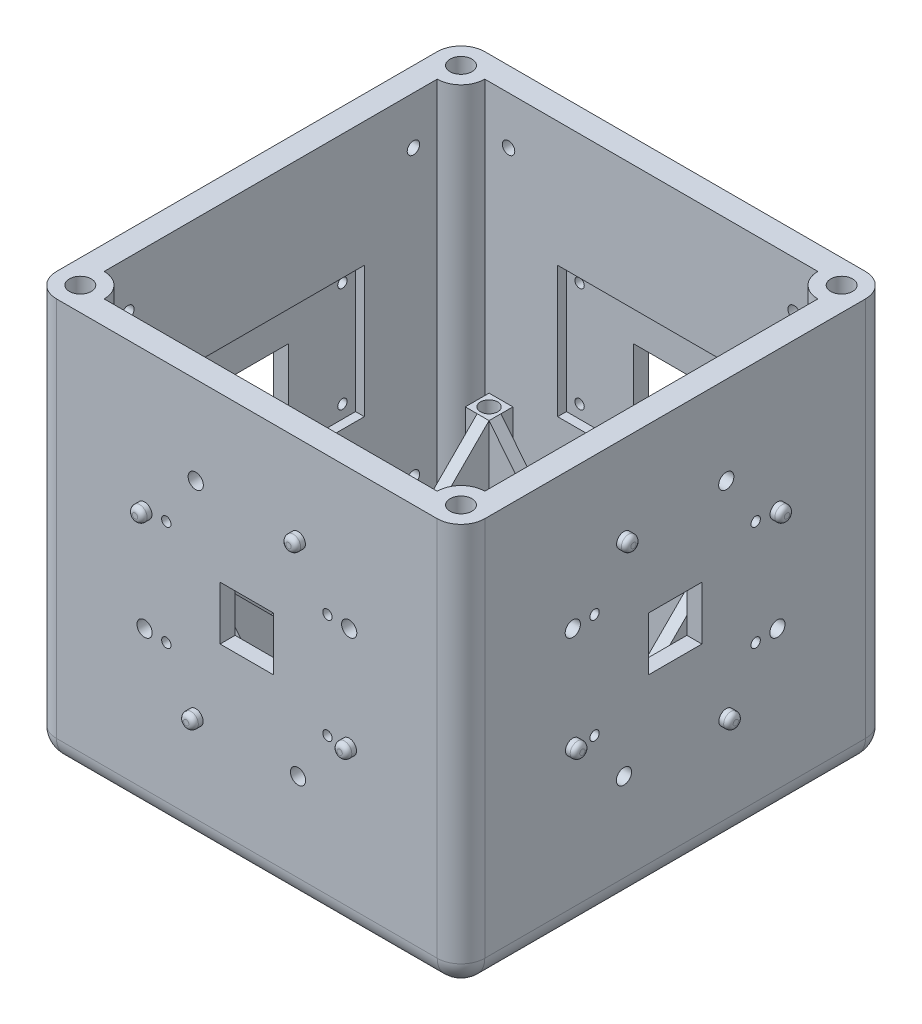
from build123d import *

# Parameters (mm, degrees)
SKETCH1_W                                    = 114.3
SKETCH1_H                                    = 114.3
BOSS_EXTRUDE1_DEPTH                          = 53.975
SHELL1_T                                     = -6.35
SKETCH3_W                                    = 6.35
SKETCH3_H                                    = 101.6
REVOLVE1_ANGLE                               = 90
MIRROR1_AT_THE_SECOND_PLANE_COPY_1_SKETC_W   = 6.35
MIRROR1_AT_THE_SECOND_PLANE_COPY_1_SKETC_H   = 101.6
MIRROR1_AT_THE_SECOND_PLANE_COPY_1_ANGLE     = 90
SKETCH16_W                                   = 14.2875
SKETCH16_H                                   = 14.2875
CUT_EXTRUDE1_DEPTH                           = 4
MIRROR4_AT_THE_SECOND_PLANE_COPY_1_SKETC_W   = 14.2875
MIRROR4_AT_THE_SECOND_PLANE_COPY_1_SKETC_H   = 14.2875
MIRROR4_AT_THE_SECOND_PLANE_COPY_1_DEPTH     = 4
FILLET1_R                                    = 6.35
SKETCH22_R                                   = 2.92
CUT_EXTRUDE5_DEPTH                           = 5.007428571
MIRROR6_AT_THE_SECOND_PLANE_COPY_1_SKETC_R   = 2.92
MIRROR6_AT_THE_SECOND_PLANE_COPY_1_DEPTH     = 5.007428571
SKETCH25_R                                   = 1.9685
BOSS_EXTRUDE2_DEPTH                          = 2.54
SKETCH25_3_R                                 = 2.032
CUT_EXTRUDE6_DEPTH                           = 3.048
FILLET5_R                                    = 1.27
MIRROR14_AT_THE_SECOND_PLANE_COPY_1_SKET_R   = 2.032
MIRROR14_AT_THE_SECOND_PLANE_COPY_1_DEPTH    = 3.048
SKETCH30_W                                   = 6.35
SKETCH30_H                                   = 6.35
BOSS_EXTRUDE4_DEPTH                          = 37.084
SKETCH31_W                                   = 29.464
SKETCH31_H                                   = 3.175
SKETCH31_W_2                                 = 3.175
SKETCH31_H_2                                 = 36.957
BOSS_EXTRUDE6_DEPTH                          = 37.084
CUT_EXTRUDE8_REACH                           = 127.765
CUT_EXTRUDE9_REACH                           = 122.103
MIRROR15_AT_THE_SECOND_PLANE_COPY_1_SKET_W   = 6.35
MIRROR15_AT_THE_SECOND_PLANE_COPY_1_SKET_H   = 6.35
MIRROR15_AT_THE_SECOND_PLANE_COPY_1_DEPTH    = 37.084
MIRROR15_AT_THE_SECOND_PLANE_COPY_2_SKET_W   = 29.464
MIRROR15_AT_THE_SECOND_PLANE_COPY_2_SKET_H   = 3.175
MIRROR15_AT_THE_SECOND_PLANE_COPY_2_SKET_W_2 = 3.175
MIRROR15_AT_THE_SECOND_PLANE_COPY_2_SKET_H_2 = 36.957
MIRROR15_AT_THE_SECOND_PLANE_COPY_2_DEPTH    = 37.084
MIRROR15_AT_THE_SECOND_PLANE_COPY_3_REACH    = 127.765
MIRROR15_AT_THE_SECOND_PLANE_COPY_4_REACH    = 122.103
SKETCH34_R                                   = 2.3
CUT_EXTRUDE10_DEPTH                          = 5.7
MIRROR16_AT_THE_SECOND_PLANE_COPY_1_SKET_R   = 2.3
MIRROR16_AT_THE_SECOND_PLANE_COPY_1_DEPTH    = 5.7
SKETCH15_W                                   = 50
SKETCH15_H                                   = 35
CUT_EXTRUDE11_DEPTH                          = 2.35
CUT_EXTRUDE12_REACH                          = 138.69
CUT_EXTRUDE13_DEPTH                          = 3.302
MIRROR17_AT_THE_SECOND_PLANE_COPY_1_SKET_W   = 50
MIRROR17_AT_THE_SECOND_PLANE_COPY_1_SKET_H   = 35
MIRROR17_AT_THE_SECOND_PLANE_COPY_1_DEPTH    = 2.35
MIRROR17_AT_THE_SECOND_PLANE_COPY_2_REACH    = 138.69
MIRROR17_AT_THE_SECOND_PLANE_COPY_3_DEPTH    = 3.302


# Read off the part's stored shape, not the designer's step: Mirror13
with BuildPart() as part:
    # Sketch1 → Boss-Extrude1 (new, symmetric)
    with BuildSketch(Plane(origin=(0, 0, 0), x_dir=(1, 0, 0), z_dir=(0, 1, 0))):
        Rectangle(SKETCH1_W, SKETCH1_H)
    extrude(amount=BOSS_EXTRUDE1_DEPTH, both=True)

    # Shell1
    shell1_openings = [part.faces().sort_by_distance(p)[0] for p in [
        (0, 53.975, 0),
    ]]
    offset(amount=SHELL1_T, openings=shell1_openings, kind=Kind.INTERSECTION)

    # Sketch3 → Revolve1 (revolve)
    with BuildSketch(Plane(origin=(-50.8, 0, 0), x_dir=(0, 0, -1), z_dir=(1, 0, 0))):
        with Locations((-47.625, 3.175)):
            Rectangle(SKETCH3_W, SKETCH3_H)
    revolve1 = revolve(axis=Axis((-50.8, 53.975, 50.8), (0, -1, 0)), revolution_arc=REVOLVE1_ANGLE)

    # Mirror1: Revolve1 across plane
    add(revolve1.mirror(Plane(origin=(0, 0, 0), x_dir=(0, 0, 1), z_dir=(1, 0, 0))))

    # Mirror1 at the second plane: Revolve1 across plane
    add(revolve1.mirror(Plane.XY))

    # Mirror1 at the second plane copy 1 sketc → Mirror1 at the second plane copy 1 (revolve)
    with BuildSketch(Plane.ZY.offset(-50.8)):
        with Locations((-47.625, 3.175)):
            Rectangle(MIRROR1_AT_THE_SECOND_PLANE_COPY_1_SKETC_W, MIRROR1_AT_THE_SECOND_PLANE_COPY_1_SKETC_H)
    revolve(axis=Axis((50.8, 53.975, -50.8), (0, -1, 0)), revolution_arc=MIRROR1_AT_THE_SECOND_PLANE_COPY_1_ANGLE)

    # Sketch16 → Cut-Extrude1 (cut)
    with BuildSketch(Plane.ZY.offset(57.15)):
        with Locations((0, 3.175)):
            Rectangle(SKETCH16_W, SKETCH16_H)
    cut_extrude1 = extrude(amount=-CUT_EXTRUDE1_DEPTH, mode=Mode.SUBTRACT)

    # Mirror4: Cut-Extrude1 across plane
    add(cut_extrude1.mirror(Plane(origin=(0, 0, 0), x_dir=(0.7071067811865465, 0, 0.7071067811865486), z_dir=(-0.7071067811865488, 0, 0.7071067811865464))), mode=Mode.SUBTRACT)

    # Mirror4 at the second plane: Cut-Extrude1 across plane
    add(cut_extrude1.mirror(Plane(origin=(0, 0, 0), x_dir=(-0.7071067811865465, 0, 0.7071067811865486), z_dir=(0.7071067811865488, 0, 0.7071067811865464))), mode=Mode.SUBTRACT)

    # Mirror4 at the second plane copy 1 sketc → Mirror4 at the second plane copy 1 (cut)
    with BuildSketch(Plane(origin=(57.15, 0, 0), x_dir=(0, 0, -1), z_dir=(1, 0, 0))):
        with Locations((0, 3.175)):
            Rectangle(MIRROR4_AT_THE_SECOND_PLANE_COPY_1_SKETC_W, MIRROR4_AT_THE_SECOND_PLANE_COPY_1_SKETC_H)
    extrude(amount=-MIRROR4_AT_THE_SECOND_PLANE_COPY_1_DEPTH, mode=Mode.SUBTRACT)

    # Fillet1
    fillet1_edges = [part.edges().sort_by_distance(p)[0] for p in [
        (0, -53.975, -57.15),
        (57.15, -53.975, 0),
        (0, -53.975, 57.15),
        (-57.15, -53.975, 0),
        (-57.15, 0, -57.15),
        (57.15, 0, -57.15),
        (57.15, 0, 57.15),
        (-57.15, 0, 57.15),
    ]]
    fillet(fillet1_edges, radius=FILLET1_R)

    # Sketch22 → Cut-Extrude5 (cut)
    with BuildSketch(Plane(origin=(0, 53.975, 0), x_dir=(1, 0, 0), z_dir=(0, 1, 0))):
        with Locations(Location((-50.8, -50.8, 0), (0, 0, 270))):
            Circle(SKETCH22_R)
    cut_extrude5 = extrude(amount=-CUT_EXTRUDE5_DEPTH, mode=Mode.SUBTRACT)

    # Mirror6: Cut-Extrude5 across plane
    add(cut_extrude5.mirror(Plane.XY), mode=Mode.SUBTRACT)

    # Mirror6 at the second plane: Cut-Extrude5 across plane
    add(cut_extrude5.mirror(Plane(origin=(0, 0, 0), x_dir=(0, 0, 1), z_dir=(1, 0, 0))), mode=Mode.SUBTRACT)

    # Mirror6 at the second plane copy 1 sketc → Mirror6 at the second plane copy 1 (cut)
    with BuildSketch(Plane(origin=(0, 53.975, 0), x_dir=(-1, 0, 0), z_dir=(0, 1, 0))):
        with Locations(Location((-50.8, -50.8, 0), (0, 0, 270))):
            Circle(MIRROR6_AT_THE_SECOND_PLANE_COPY_1_SKETC_R)
    extrude(amount=-MIRROR6_AT_THE_SECOND_PLANE_COPY_1_DEPTH, mode=Mode.SUBTRACT)

    # Sketch25 → Boss-Extrude2 (add)
    with BuildSketch(Plane.XY.offset(57.15)):
        with Locations(Location((-27.305, 16.8275, 0), (0, 0, 180))):
            Circle(SKETCH25_R)
        with Locations(Location((13.6525, 30.48, 0), (0, 0, 180))):
            Circle(SKETCH25_R)
        with Locations(Location((27.305, -10.4775, 0), (0, 0, 180))):
            Circle(SKETCH25_R)
        with Locations(Location((-13.6525, -24.13, 0), (0, 0, 180))):
            Circle(SKETCH25_R)
    extrude(amount=BOSS_EXTRUDE2_DEPTH)

    # Sketch25<3> → Cut-Extrude6 (cut)
    with BuildSketch(Plane.XY.offset(57.15)):
        with Locations((-27.305, -10.4775)):
            Circle(SKETCH25_3_R)
        with Locations((-13.6525, 30.48)):
            Circle(SKETCH25_3_R)
        with Locations((27.305, 16.8275)):
            Circle(SKETCH25_3_R)
        with Locations((13.6525, -24.13)):
            Circle(SKETCH25_3_R)
    cut_extrude6 = extrude(amount=-CUT_EXTRUDE6_DEPTH, mode=Mode.SUBTRACT)

    # Fillet5
    fillet5_edges = [part.edges().sort_by_distance(p)[0] for p in [
        (15.621, 30.48, 59.69),
        (29.2735, -10.4775, 59.69),
        (-11.684, -24.13, 59.69),
        (-25.3365, 16.8275, 59.69),
    ]]
    fillet(fillet5_edges, radius=FILLET5_R)

    # Mirror13 outline → Mirror13 (revolve)
    with BuildSketch(Plane(origin=(0, -24.13, 13.6525), x_dir=(0, 1, 0), z_dir=(0, 0, -1))):
        with BuildLine():
            ThreePointArc((0.6985, -59.69), (1.596525612, -59.318025612), (1.9685, -58.42))
            Line((1.9685, -58.42), (1.9685, -57.15))
            Line((1.9685, -57.15), (0, -57.15))
            Line((0, -57.15), (0, -59.69))
            Line((0, -59.69), (0.6985, -59.69))
        make_face()
    revolve(axis=Axis((0, -24.13, 13.6525), (1, 0, 0)))

    # Mirror13 2 outline → Mirror13 2 (revolve)
    with BuildSketch(Plane(origin=(0, -10.4775, -27.305), x_dir=(0, 1, 0), z_dir=(0, 0, -1))):
        with BuildLine():
            Line((0, -57.15), (0, -59.69))
            Line((0, -59.69), (0.6985, -59.69))
            ThreePointArc((0.6985, -59.69), (1.596525612, -59.318025612), (1.9685, -58.42))
            Line((1.9685, -58.42), (1.9685, -57.15))
            Line((1.9685, -57.15), (0, -57.15))
        make_face()
    revolve(axis=Axis((0, -10.4775, -27.305), (1, 0, 0)))

    # Mirror13 3 outline → Mirror13 3 (revolve)
    with BuildSketch(Plane(origin=(0, 30.48, -13.6525), x_dir=(0, 1, 0), z_dir=(0, 0, -1))):
        with BuildLine():
            Line((0, -57.15), (0, -59.69))
            Line((0, -59.69), (0.6985, -59.69))
            ThreePointArc((0.6985, -59.69), (1.596525612, -59.318025612), (1.9685, -58.42))
            Line((1.9685, -58.42), (1.9685, -57.15))
            Line((1.9685, -57.15), (0, -57.15))
        make_face()
    revolve(axis=Axis((0, 30.48, -13.6525), (1, 0, 0)))

    # Mirror13 4 outline → Mirror13 4 (revolve)
    with BuildSketch(Plane(origin=(0, 16.8275, 27.305), x_dir=(0, 1, 0), z_dir=(0, 0, -1))):
        with BuildLine():
            Line((0, -57.15), (0, -59.69))
            Line((0, -59.69), (0.6985, -59.69))
            ThreePointArc((0.6985, -59.69), (1.596525612, -59.318025612), (1.9685, -58.42))
            Line((1.9685, -58.42), (1.9685, -57.15))
            Line((1.9685, -57.15), (0, -57.15))
        make_face()
    revolve(axis=Axis((0, 16.8275, 27.305), (1, 0, 0)))

    # Mirror13 5 outline → Mirror13 5 (revolve)
    with BuildSketch(Plane(origin=(0, -24.13, -13.6525), x_dir=(0, 1, 0), z_dir=(0, 0, -1))):
        with BuildLine():
            Line((1.9685, 57.15), (1.9685, 58.42))
            ThreePointArc((1.9685, 58.42), (1.596525612, 59.318025612), (0.6985, 59.69))
            Line((0.6985, 59.69), (0, 59.69))
            Line((0, 59.69), (0, 57.15))
            Line((0, 57.15), (1.9685, 57.15))
        make_face()
    revolve(axis=Axis((0, -24.13, -13.6525), (1, 0, 0)))

    # Mirror13 6 outline → Mirror13 6 (revolve)
    with BuildSketch(Plane(origin=(0, -10.4775, 27.305), x_dir=(0, 1, 0), z_dir=(0, 0, -1))):
        with BuildLine():
            Line((0.6985, 59.69), (0, 59.69))
            Line((0, 59.69), (0, 57.15))
            Line((0, 57.15), (1.9685, 57.15))
            Line((1.9685, 57.15), (1.9685, 58.42))
            ThreePointArc((1.9685, 58.42), (1.596525612, 59.318025612), (0.6985, 59.69))
        make_face()
    revolve(axis=Axis((0, -10.4775, 27.305), (1, 0, 0)))

    # Mirror13 7 outline → Mirror13 7 (revolve)
    with BuildSketch(Plane(origin=(0, 30.48, 13.6525), x_dir=(0, 1, 0), z_dir=(0, 0, -1))):
        with BuildLine():
            Line((0.6985, 59.69), (0, 59.69))
            Line((0, 59.69), (0, 57.15))
            Line((0, 57.15), (1.9685, 57.15))
            Line((1.9685, 57.15), (1.9685, 58.42))
            ThreePointArc((1.9685, 58.42), (1.596525612, 59.318025612), (0.6985, 59.69))
        make_face()
    revolve(axis=Axis((0, 30.48, 13.6525), (1, 0, 0)))

    # Mirror13 8 outline → Mirror13 8 (revolve)
    with BuildSketch(Plane(origin=(0, 16.8275, -27.305), x_dir=(0, 1, 0), z_dir=(0, 0, -1))):
        with BuildLine():
            Line((0.6985, 59.69), (0, 59.69))
            Line((0, 59.69), (0, 57.15))
            Line((0, 57.15), (1.9685, 57.15))
            Line((1.9685, 57.15), (1.9685, 58.42))
            ThreePointArc((1.9685, 58.42), (1.596525612, 59.318025612), (0.6985, 59.69))
        make_face()
    revolve(axis=Axis((0, 16.8275, -27.305), (1, 0, 0)))

    # Mirror13 9 outline → Mirror13 9 (revolve)
    with BuildSketch(Plane(origin=(13.6525, -24.13, 0), x_dir=(1, 0, 0), z_dir=(0, -1, 0))):
        with BuildLine():
            ThreePointArc((0.6985, -59.69), (1.596525612, -59.318025612), (1.9685, -58.42))
            Line((1.9685, -58.42), (1.9685, -57.15))
            Line((1.9685, -57.15), (0, -57.15))
            Line((0, -57.15), (0, -59.69))
            Line((0, -59.69), (0.6985, -59.69))
        make_face()
    revolve(axis=Axis((13.6525, -24.13, 0), (0, 0, 1)))

    # Mirror13 10 outline → Mirror13 10 (revolve)
    with BuildSketch(Plane(origin=(-27.305, -10.4775, 0), x_dir=(1, 0, 0), z_dir=(0, -1, 0))):
        with BuildLine():
            Line((0, -57.15), (0, -59.69))
            Line((0, -59.69), (0.6985, -59.69))
            ThreePointArc((0.6985, -59.69), (1.596525612, -59.318025612), (1.9685, -58.42))
            Line((1.9685, -58.42), (1.9685, -57.15))
            Line((1.9685, -57.15), (0, -57.15))
        make_face()
    revolve(axis=Axis((-27.305, -10.4775, 0), (0, 0, 1)))

    # Mirror13 11 outline → Mirror13 11 (revolve)
    with BuildSketch(Plane(origin=(-13.6525, 30.48, 0), x_dir=(1, 0, 0), z_dir=(0, -1, 0))):
        with BuildLine():
            Line((0, -57.15), (0, -59.69))
            Line((0, -59.69), (0.6985, -59.69))
            ThreePointArc((0.6985, -59.69), (1.596525612, -59.318025612), (1.9685, -58.42))
            Line((1.9685, -58.42), (1.9685, -57.15))
            Line((1.9685, -57.15), (0, -57.15))
        make_face()
    revolve(axis=Axis((-13.6525, 30.48, 0), (0, 0, 1)))

    # Mirror13 12 outline → Mirror13 12 (revolve)
    with BuildSketch(Plane(origin=(27.305, 16.8275, 0), x_dir=(1, 0, 0), z_dir=(0, -1, 0))):
        with BuildLine():
            Line((0, -57.15), (0, -59.69))
            Line((0, -59.69), (0.6985, -59.69))
            ThreePointArc((0.6985, -59.69), (1.596525612, -59.318025612), (1.9685, -58.42))
            Line((1.9685, -58.42), (1.9685, -57.15))
            Line((1.9685, -57.15), (0, -57.15))
        make_face()
    revolve(axis=Axis((27.305, 16.8275, 0), (0, 0, 1)))

    # Mirror14: Cut-Extrude6 across plane
    add(cut_extrude6.mirror(Plane(origin=(0, 0, 0), x_dir=(0.7071067811865465, 0, 0.7071067811865486), z_dir=(-0.7071067811865488, 0, 0.7071067811865464))), mode=Mode.SUBTRACT)

    # Mirror14 at the second plane: Cut-Extrude6 across plane
    add(cut_extrude6.mirror(Plane(origin=(0, 0, 0), x_dir=(-0.7071067811865465, 0, 0.7071067811865486), z_dir=(0.7071067811865488, 0, 0.7071067811865464))), mode=Mode.SUBTRACT)

    # Mirror14 at the second plane copy 1 sket → Mirror14 at the second plane copy 1 (cut)
    with BuildSketch(Plane(origin=(0, 0, -57.15), x_dir=(-1, 0, 0), z_dir=(0, 0, -1))):
        with Locations((-27.305, -10.4775)):
            Circle(MIRROR14_AT_THE_SECOND_PLANE_COPY_1_SKET_R)
        with Locations((-13.6525, 30.48)):
            Circle(MIRROR14_AT_THE_SECOND_PLANE_COPY_1_SKET_R)
        with Locations((27.305, 16.8275)):
            Circle(MIRROR14_AT_THE_SECOND_PLANE_COPY_1_SKET_R)
        with Locations((13.6525, -24.13)):
            Circle(MIRROR14_AT_THE_SECOND_PLANE_COPY_1_SKET_R)
    extrude(amount=-MIRROR14_AT_THE_SECOND_PLANE_COPY_1_DEPTH, mode=Mode.SUBTRACT)

    # Sketch30 → Boss-Extrude4 (add)
    with BuildSketch(Plane(origin=(0, -47.625, 0), x_dir=(1, 0, 0), z_dir=(0, 1, 0))):
        with Locations((-32.639, 40.132)):
            Rectangle(SKETCH30_W, SKETCH30_H)
    boss_extrude4 = extrude(amount=BOSS_EXTRUDE4_DEPTH)

    # Sketch31 → Boss-Extrude6 (add)
    with BuildSketch(Plane(origin=(0, -47.625, 0), x_dir=(1, 0, 0), z_dir=(0, 1, 0))):
        with Locations((-14.732, 38.5445)):
            Rectangle(SKETCH31_W, SKETCH31_H)
        with Locations((-31.0515, 18.4785)):
            Rectangle(SKETCH31_W_2, SKETCH31_H_2)
    boss_extrude6 = extrude(amount=BOSS_EXTRUDE6_DEPTH)

    # Sketch32 → Cut-Extrude8 (cut, up to next)
    with BuildSketch(Plane.XY.offset(-36.957), mode=Mode.PRIVATE) as cut_extrude8_sk1:
        Polygon((-29.464, -10.541), (0, -47.625), (0, -10.541), align=None)
    cut_extrude8_tool1 = extrude(cut_extrude8_sk1.sketch, amount=-CUT_EXTRUDE8_REACH, mode=Mode.PRIVATE) & part.part
    cut_extrude8 = cut_extrude8_tool1.solids().sort_by_distance((-9.821333, -22.902333, -36.957))[0]
    add(cut_extrude8, mode=Mode.SUBTRACT)

    # Sketch33 → Cut-Extrude9 (cut, up to next)
    with BuildSketch(Plane(origin=(-29.464, 0, 0), x_dir=(0, 0, -1), z_dir=(1, 0, 0)), mode=Mode.PRIVATE) as cut_extrude9_sk1:
        Polygon((0, -47.625), (36.957, -10.541), (0, -10.541), align=None)
    cut_extrude9_tool1 = extrude(cut_extrude9_sk1.sketch, amount=-CUT_EXTRUDE9_REACH, mode=Mode.PRIVATE) & part.part
    cut_extrude9 = cut_extrude9_tool1.solids().sort_by_distance((-29.464, -22.902333, -12.319))[0]
    add(cut_extrude9, mode=Mode.SUBTRACT)

    # Mirror15: Boss-Extrude4, Boss-Extrude6, Cut-Extrude8, Cut-Extrude9 across plane
    add(boss_extrude4.mirror(Plane.XY))
    add(boss_extrude6.mirror(Plane.XY))
    add(cut_extrude8.mirror(Plane.XY), mode=Mode.SUBTRACT)
    add(cut_extrude9.mirror(Plane.XY), mode=Mode.SUBTRACT)

    # Mirror15 at the second plane: Boss-Extrude4, Boss-Extrude6, Cut-Extrude8, Cut-Extrude9 across plane
    add(boss_extrude4.mirror(Plane(origin=(0, 0, 0), x_dir=(0, 0, 1), z_dir=(1, 0, 0))))
    add(boss_extrude6.mirror(Plane(origin=(0, 0, 0), x_dir=(0, 0, 1), z_dir=(1, 0, 0))))
    add(cut_extrude8.mirror(Plane(origin=(0, 0, 0), x_dir=(0, 0, 1), z_dir=(1, 0, 0))), mode=Mode.SUBTRACT)
    add(cut_extrude9.mirror(Plane(origin=(0, 0, 0), x_dir=(0, 0, 1), z_dir=(1, 0, 0))), mode=Mode.SUBTRACT)

    # Mirror15 at the second plane copy 1 sket → Mirror15 at the second plane copy 1 (add)
    with BuildSketch(Plane(origin=(0, -47.625, 0), x_dir=(-1, 0, 0), z_dir=(0, 1, 0))):
        with Locations((-32.639, 40.132)):
            Rectangle(MIRROR15_AT_THE_SECOND_PLANE_COPY_1_SKET_W, MIRROR15_AT_THE_SECOND_PLANE_COPY_1_SKET_H)
    extrude(amount=MIRROR15_AT_THE_SECOND_PLANE_COPY_1_DEPTH)

    # Mirror15 at the second plane copy 2 sket → Mirror15 at the second plane copy 2 (add)
    with BuildSketch(Plane(origin=(0, -47.625, 0), x_dir=(-1, 0, 0), z_dir=(0, 1, 0))):
        with Locations((-14.732, 38.5445)):
            Rectangle(MIRROR15_AT_THE_SECOND_PLANE_COPY_2_SKET_W, MIRROR15_AT_THE_SECOND_PLANE_COPY_2_SKET_H)
        with Locations((-31.0515, 18.4785)):
            Rectangle(MIRROR15_AT_THE_SECOND_PLANE_COPY_2_SKET_W_2, MIRROR15_AT_THE_SECOND_PLANE_COPY_2_SKET_H_2)
    extrude(amount=MIRROR15_AT_THE_SECOND_PLANE_COPY_2_DEPTH)

    # Mirror15 at the second plane copy 3 sket → Mirror15 at the second plane copy 3 (cut, up to next)
    with BuildSketch(Plane(origin=(0, 0, 36.957), x_dir=(-1, 0, 0), z_dir=(0, 0, -1)), mode=Mode.PRIVATE) as mirror15_at_the_second_plane_copy_3_sk1:
        Polygon((-29.464, -10.541), (0, -47.625), (0, -10.541), align=None)
    mirror15_at_the_second_plane_copy_3_tool1 = extrude(mirror15_at_the_second_plane_copy_3_sk1.sketch, amount=-MIRROR15_AT_THE_SECOND_PLANE_COPY_3_REACH, mode=Mode.PRIVATE) & part.part
    add(mirror15_at_the_second_plane_copy_3_tool1.solids().sort_by_distance((9.821333, -22.902333, 36.957))[0], mode=Mode.SUBTRACT)

    # Mirror15 at the second plane copy 4 sket → Mirror15 at the second plane copy 4 (cut, up to next)
    with BuildSketch(Plane.ZY.offset(-29.464), mode=Mode.PRIVATE) as mirror15_at_the_second_plane_copy_4_sk1:
        Polygon((0, -47.625), (36.957, -10.541), (0, -10.541), align=None)
    mirror15_at_the_second_plane_copy_4_tool1 = extrude(mirror15_at_the_second_plane_copy_4_sk1.sketch, amount=-MIRROR15_AT_THE_SECOND_PLANE_COPY_4_REACH, mode=Mode.PRIVATE) & part.part
    add(mirror15_at_the_second_plane_copy_4_tool1.solids().sort_by_distance((29.464, -22.902333, 12.319))[0], mode=Mode.SUBTRACT)

    # Sketch34 → Cut-Extrude10 (cut)
    with BuildSketch(Plane(origin=(0, -10.541, 0), x_dir=(1, 0, 0), z_dir=(0, 1, 0))):
        with Locations(Location((-32.639, 40.132, 0), (0, 0, 270))):
            Circle(SKETCH34_R)
    cut_extrude10 = extrude(amount=-CUT_EXTRUDE10_DEPTH, mode=Mode.SUBTRACT)

    # Mirror16: Cut-Extrude10 across plane
    add(cut_extrude10.mirror(Plane(origin=(0, 0, 0), x_dir=(0, 0, 1), z_dir=(1, 0, 0))), mode=Mode.SUBTRACT)

    # Mirror16 at the second plane: Cut-Extrude10 across plane
    add(cut_extrude10.mirror(Plane.XY), mode=Mode.SUBTRACT)

    # Mirror16 at the second plane copy 1 sket → Mirror16 at the second plane copy 1 (cut)
    with BuildSketch(Plane(origin=(0, -10.541, 0), x_dir=(-1, 0, 0), z_dir=(0, 1, 0))):
        with Locations(Location((-32.639, 40.132, 0), (0, 0, 270))):
            Circle(MIRROR16_AT_THE_SECOND_PLANE_COPY_1_SKET_R)
    extrude(amount=-MIRROR16_AT_THE_SECOND_PLANE_COPY_1_DEPTH, mode=Mode.SUBTRACT)

    # Sketch15 → Cut-Extrude11 (cut)
    with BuildSketch(Plane(origin=(-50.8, 0, 0), x_dir=(0, 0, -1), z_dir=(1, 0, 0))):
        with Locations((0, 3.175)):
            Rectangle(SKETCH15_W, SKETCH15_H)
    cut_extrude11 = extrude(amount=-CUT_EXTRUDE11_DEPTH, mode=Mode.SUBTRACT)

    # Sketch19 → Cut-Extrude12 (cut, up to next)
    with BuildSketch(Plane(origin=(-50.8, 0, 0), x_dir=(0, 0, -1), z_dir=(1, 0, 0)), mode=Mode.PRIVATE) as cut_extrude12_sk1:
        with BuildLine():
            Line((-21.5, 15.925), (-21.5, 17.175))
            Line((-21.5, 17.175), (-20.25, 17.175))
            ThreePointArc((-20.25, 17.175), (-22.383883476, 18.058883476), (-21.5, 15.925))
        make_face()
    cut_extrude12_tool1 = extrude(cut_extrude12_sk1.sketch, amount=-CUT_EXTRUDE12_REACH, mode=Mode.PRIVATE) & part.part
    # Sketch19 → Cut-Extrude12 (cut, up to next)
    with BuildSketch(Plane(origin=(-50.8, 0, 0), x_dir=(0, 0, -1), z_dir=(1, 0, 0)), mode=Mode.PRIVATE) as cut_extrude12_sk2:
        with BuildLine():
            Line((-20.25, 17.175), (-21.5, 17.175))
            Line((-21.5, 17.175), (-21.5, 15.925))
            ThreePointArc((-21.5, 15.925), (-20.616116524, 16.291116524), (-20.25, 17.175))
        make_face()
    cut_extrude12_tool2 = extrude(cut_extrude12_sk2.sketch, amount=-CUT_EXTRUDE12_REACH, mode=Mode.PRIVATE) & part.part
    # Sketch19 → Cut-Extrude12 (cut, up to next)
    with BuildSketch(Plane(origin=(-50.8, 0, 0), x_dir=(0, 0, -1), z_dir=(1, 0, 0)), mode=Mode.PRIVATE) as cut_extrude12_sk3:
        with BuildLine():
            Line((-21.5, 15.925), (-21.5, 17.175))
            Line((-21.5, 17.175), (-20.25, 17.175))
            ThreePointArc((-20.25, 17.175), (-22.383883476, 18.058883476), (-21.5, 15.925))
        make_face()
    cut_extrude12_tool3 = extrude(cut_extrude12_sk3.sketch, amount=-CUT_EXTRUDE12_REACH, mode=Mode.PRIVATE) & part.part
    # Sketch19 → Cut-Extrude12 (cut, up to next)
    with BuildSketch(Plane(origin=(-50.8, 0, 0), x_dir=(0, 0, -1), z_dir=(1, 0, 0)), mode=Mode.PRIVATE) as cut_extrude12_sk4:
        with BuildLine():
            Line((-20.25, 17.175), (-21.5, 17.175))
            Line((-21.5, 17.175), (-21.5, 15.925))
            ThreePointArc((-21.5, 15.925), (-20.616116524, 16.291116524), (-20.25, 17.175))
        make_face()
    cut_extrude12_tool4 = extrude(cut_extrude12_sk4.sketch, amount=-CUT_EXTRUDE12_REACH, mode=Mode.PRIVATE) & part.part
    # Sketch19 → Cut-Extrude12 (cut, up to next)
    with BuildSketch(Plane(origin=(-50.8, 0, 0), x_dir=(0, 0, -1), z_dir=(1, 0, 0)), mode=Mode.PRIVATE) as cut_extrude12_sk5:
        with BuildLine():
            ThreePointArc((22.75, 17.175), (21.5, 18.425), (20.25, 17.175))
            Line((20.25, 17.175), (21.5, 17.175))
            Line((21.5, 17.175), (21.5, 15.925))
            ThreePointArc((21.5, 15.925), (22.383883476, 16.291116524), (22.75, 17.175))
        make_face()
    cut_extrude12_tool5 = extrude(cut_extrude12_sk5.sketch, amount=-CUT_EXTRUDE12_REACH, mode=Mode.PRIVATE) & part.part
    # Sketch19 → Cut-Extrude12 (cut, up to next)
    with BuildSketch(Plane(origin=(-50.8, 0, 0), x_dir=(0, 0, -1), z_dir=(1, 0, 0)), mode=Mode.PRIVATE) as cut_extrude12_sk6:
        with BuildLine():
            Line((21.5, 17.175), (20.25, 17.175))
            ThreePointArc((20.25, 17.175), (20.616116524, 16.291116524), (21.5, 15.925))
            Line((21.5, 15.925), (21.5, 17.175))
        make_face()
    cut_extrude12_tool6 = extrude(cut_extrude12_sk6.sketch, amount=-CUT_EXTRUDE12_REACH, mode=Mode.PRIVATE) & part.part
    # Sketch19 → Cut-Extrude12 (cut, up to next)
    with BuildSketch(Plane(origin=(-50.8, 0, 0), x_dir=(0, 0, -1), z_dir=(1, 0, 0)), mode=Mode.PRIVATE) as cut_extrude12_sk7:
        with BuildLine():
            ThreePointArc((22.75, 17.175), (21.5, 18.425), (20.25, 17.175))
            Line((20.25, 17.175), (21.5, 17.175))
            Line((21.5, 17.175), (21.5, 15.925))
            ThreePointArc((21.5, 15.925), (22.383883476, 16.291116524), (22.75, 17.175))
        make_face()
    cut_extrude12_tool7 = extrude(cut_extrude12_sk7.sketch, amount=-CUT_EXTRUDE12_REACH, mode=Mode.PRIVATE) & part.part
    # Sketch19 → Cut-Extrude12 (cut, up to next)
    with BuildSketch(Plane(origin=(-50.8, 0, 0), x_dir=(0, 0, -1), z_dir=(1, 0, 0)), mode=Mode.PRIVATE) as cut_extrude12_sk8:
        with BuildLine():
            Line((21.5, 17.175), (20.25, 17.175))
            ThreePointArc((20.25, 17.175), (20.616116524, 16.291116524), (21.5, 15.925))
            Line((21.5, 15.925), (21.5, 17.175))
        make_face()
    cut_extrude12_tool8 = extrude(cut_extrude12_sk8.sketch, amount=-CUT_EXTRUDE12_REACH, mode=Mode.PRIVATE) & part.part
    # Sketch19 → Cut-Extrude12 (cut, up to next)
    with BuildSketch(Plane(origin=(-50.8, 0, 0), x_dir=(0, 0, -1), z_dir=(1, 0, 0)), mode=Mode.PRIVATE) as cut_extrude12_sk9:
        with BuildLine():
            ThreePointArc((22.75, -10.825), (22.383883476, -9.941116524), (21.5, -9.575))
            Line((21.5, -9.575), (21.5, -10.825))
            Line((21.5, -10.825), (20.25, -10.825))
            ThreePointArc((20.25, -10.825), (21.5, -12.075), (22.75, -10.825))
        make_face()
    cut_extrude12_tool9 = extrude(cut_extrude12_sk9.sketch, amount=-CUT_EXTRUDE12_REACH, mode=Mode.PRIVATE) & part.part
    # Sketch19 → Cut-Extrude12 (cut, up to next)
    with BuildSketch(Plane(origin=(-50.8, 0, 0), x_dir=(0, 0, -1), z_dir=(1, 0, 0)), mode=Mode.PRIVATE) as cut_extrude12_sk10:
        with BuildLine():
            Line((21.5, -10.825), (21.5, -9.575))
            ThreePointArc((21.5, -9.575), (20.616116524, -9.941116524), (20.25, -10.825))
            Line((20.25, -10.825), (21.5, -10.825))
        make_face()
    cut_extrude12_tool10 = extrude(cut_extrude12_sk10.sketch, amount=-CUT_EXTRUDE12_REACH, mode=Mode.PRIVATE) & part.part
    # Sketch19 → Cut-Extrude12 (cut, up to next)
    with BuildSketch(Plane(origin=(-50.8, 0, 0), x_dir=(0, 0, -1), z_dir=(1, 0, 0)), mode=Mode.PRIVATE) as cut_extrude12_sk11:
        with BuildLine():
            ThreePointArc((22.75, -10.825), (22.383883476, -9.941116524), (21.5, -9.575))
            Line((21.5, -9.575), (21.5, -10.825))
            Line((21.5, -10.825), (20.25, -10.825))
            ThreePointArc((20.25, -10.825), (21.5, -12.075), (22.75, -10.825))
        make_face()
    cut_extrude12_tool11 = extrude(cut_extrude12_sk11.sketch, amount=-CUT_EXTRUDE12_REACH, mode=Mode.PRIVATE) & part.part
    # Sketch19 → Cut-Extrude12 (cut, up to next)
    with BuildSketch(Plane(origin=(-50.8, 0, 0), x_dir=(0, 0, -1), z_dir=(1, 0, 0)), mode=Mode.PRIVATE) as cut_extrude12_sk12:
        with BuildLine():
            Line((21.5, -10.825), (21.5, -9.575))
            ThreePointArc((21.5, -9.575), (20.616116524, -9.941116524), (20.25, -10.825))
            Line((20.25, -10.825), (21.5, -10.825))
        make_face()
    cut_extrude12_tool12 = extrude(cut_extrude12_sk12.sketch, amount=-CUT_EXTRUDE12_REACH, mode=Mode.PRIVATE) & part.part
    # Sketch19 → Cut-Extrude12 (cut, up to next)
    with BuildSketch(Plane(origin=(-50.8, 0, 0), x_dir=(0, 0, -1), z_dir=(1, 0, 0)), mode=Mode.PRIVATE) as cut_extrude12_sk13:
        with BuildLine():
            ThreePointArc((-20.25, -10.825), (-20.616116524, -9.941116524), (-21.5, -9.575))
            Line((-21.5, -9.575), (-21.5, -10.825))
            Line((-21.5, -10.825), (-20.25, -10.825))
        make_face()
    cut_extrude12_tool13 = extrude(cut_extrude12_sk13.sketch, amount=-CUT_EXTRUDE12_REACH, mode=Mode.PRIVATE) & part.part
    # Sketch19 → Cut-Extrude12 (cut, up to next)
    with BuildSketch(Plane(origin=(-50.8, 0, 0), x_dir=(0, 0, -1), z_dir=(1, 0, 0)), mode=Mode.PRIVATE) as cut_extrude12_sk14:
        with BuildLine():
            Line((-21.5, -10.825), (-21.5, -9.575))
            ThreePointArc((-21.5, -9.575), (-22.383883476, -11.708883476), (-20.25, -10.825))
            Line((-20.25, -10.825), (-21.5, -10.825))
        make_face()
    cut_extrude12_tool14 = extrude(cut_extrude12_sk14.sketch, amount=-CUT_EXTRUDE12_REACH, mode=Mode.PRIVATE) & part.part
    # Sketch19 → Cut-Extrude12 (cut, up to next)
    with BuildSketch(Plane(origin=(-50.8, 0, 0), x_dir=(0, 0, -1), z_dir=(1, 0, 0)), mode=Mode.PRIVATE) as cut_extrude12_sk15:
        with BuildLine():
            ThreePointArc((-20.25, -10.825), (-20.616116524, -9.941116524), (-21.5, -9.575))
            Line((-21.5, -9.575), (-21.5, -10.825))
            Line((-21.5, -10.825), (-20.25, -10.825))
        make_face()
    cut_extrude12_tool15 = extrude(cut_extrude12_sk15.sketch, amount=-CUT_EXTRUDE12_REACH, mode=Mode.PRIVATE) & part.part
    # Sketch19 → Cut-Extrude12 (cut, up to next)
    with BuildSketch(Plane(origin=(-50.8, 0, 0), x_dir=(0, 0, -1), z_dir=(1, 0, 0)), mode=Mode.PRIVATE) as cut_extrude12_sk16:
        with BuildLine():
            Line((-21.5, -10.825), (-21.5, -9.575))
            ThreePointArc((-21.5, -9.575), (-22.383883476, -11.708883476), (-20.25, -10.825))
            Line((-20.25, -10.825), (-21.5, -10.825))
        make_face()
    cut_extrude12_tool16 = extrude(cut_extrude12_sk16.sketch, amount=-CUT_EXTRUDE12_REACH, mode=Mode.PRIVATE) & part.part
    cut_extrude12_1 = cut_extrude12_tool1.solids().sort_by_distance((-50.8, 17.351839, 21.676839))[0]
    add(cut_extrude12_1, mode=Mode.SUBTRACT)
    cut_extrude12_2 = cut_extrude12_tool2.solids().sort_by_distance((-50.8, 16.644484, 20.969484))[0]
    add(cut_extrude12_2, mode=Mode.SUBTRACT)
    cut_extrude12_3 = cut_extrude12_tool3.solids().sort_by_distance((-50.8, 17.351839, 21.676839))[0]
    add(cut_extrude12_3, mode=Mode.SUBTRACT)
    cut_extrude12_4 = cut_extrude12_tool4.solids().sort_by_distance((-50.8, 16.644484, 20.969484))[0]
    add(cut_extrude12_4, mode=Mode.SUBTRACT)
    cut_extrude12_5 = cut_extrude12_tool5.solids().sort_by_distance((-50.8, 17.351839, -21.676839))[0]
    add(cut_extrude12_5, mode=Mode.SUBTRACT)
    cut_extrude12_6 = cut_extrude12_tool6.solids().sort_by_distance((-50.8, 16.644484, -20.969484))[0]
    add(cut_extrude12_6, mode=Mode.SUBTRACT)
    cut_extrude12_7 = cut_extrude12_tool7.solids().sort_by_distance((-50.8, 17.351839, -21.676839))[0]
    add(cut_extrude12_7, mode=Mode.SUBTRACT)
    cut_extrude12_8 = cut_extrude12_tool8.solids().sort_by_distance((-50.8, 16.644484, -20.969484))[0]
    add(cut_extrude12_8, mode=Mode.SUBTRACT)
    cut_extrude12_9 = cut_extrude12_tool9.solids().sort_by_distance((-50.8, -11.001839, -21.676839))[0]
    add(cut_extrude12_9, mode=Mode.SUBTRACT)
    cut_extrude12_10 = cut_extrude12_tool10.solids().sort_by_distance((-50.8, -10.294484, -20.969484))[0]
    add(cut_extrude12_10, mode=Mode.SUBTRACT)
    cut_extrude12_11 = cut_extrude12_tool11.solids().sort_by_distance((-50.8, -11.001839, -21.676839))[0]
    add(cut_extrude12_11, mode=Mode.SUBTRACT)
    cut_extrude12_12 = cut_extrude12_tool12.solids().sort_by_distance((-50.8, -10.294484, -20.969484))[0]
    add(cut_extrude12_12, mode=Mode.SUBTRACT)
    cut_extrude12_13 = cut_extrude12_tool13.solids().sort_by_distance((-50.8, -10.294484, 20.969484))[0]
    add(cut_extrude12_13, mode=Mode.SUBTRACT)
    cut_extrude12_14 = cut_extrude12_tool14.solids().sort_by_distance((-50.8, -11.001839, 21.676839))[0]
    add(cut_extrude12_14, mode=Mode.SUBTRACT)
    cut_extrude12_15 = cut_extrude12_tool15.solids().sort_by_distance((-50.8, -10.294484, 20.969484))[0]
    add(cut_extrude12_15, mode=Mode.SUBTRACT)
    cut_extrude12_16 = cut_extrude12_tool16.solids().sort_by_distance((-50.8, -11.001839, 21.676839))[0]
    add(cut_extrude12_16, mode=Mode.SUBTRACT)
    cut_extrude12 = cut_extrude12_1 + cut_extrude12_2 + cut_extrude12_3 + cut_extrude12_4 + cut_extrude12_5 + cut_extrude12_6 + cut_extrude12_7 + cut_extrude12_8 + cut_extrude12_9 + cut_extrude12_10 + cut_extrude12_11 + cut_extrude12_12 + cut_extrude12_13 + cut_extrude12_14 + cut_extrude12_15 + cut_extrude12_16  # Cut-Extrude12 as one shape, for the pattern or mirror that repeats it

    # Sketch37 → Cut-Extrude13 (cut)
    with BuildSketch(Plane(origin=(-50.8, 0, 0), x_dir=(0, 0, -1), z_dir=(1, 0, 0))):
        with BuildLine():
            Line((-38.1, 39.624), (-38.1, 41.275))
            Line((-38.1, 41.275), (-36.449, 41.275))
            ThreePointArc((-36.449, 41.275), (-39.267433296, 42.442433296), (-38.1, 39.624))
        make_face()
        with BuildLine():
            Line((-36.449, 41.275), (-38.1, 41.275))
            Line((-38.1, 41.275), (-38.1, 39.624))
            ThreePointArc((-38.1, 39.624), (-36.932566704, 40.107566704), (-36.449, 41.275))
        make_face()
        with BuildLine():
            ThreePointArc((39.751, 41.275), (38.1, 42.926), (36.449, 41.275))
            Line((36.449, 41.275), (38.1, 41.275))
            Line((38.1, 41.275), (38.1, 39.624))
            ThreePointArc((38.1, 39.624), (39.267433296, 40.107566704), (39.751, 41.275))
        make_face()
        with BuildLine():
            Line((38.1, 41.275), (36.449, 41.275))
            ThreePointArc((36.449, 41.275), (36.932566704, 40.107566704), (38.1, 39.624))
            Line((38.1, 39.624), (38.1, 41.275))
        make_face()
        with BuildLine():
            ThreePointArc((39.751, -34.925), (39.267433296, -33.757566704), (38.1, -33.274))
            Line((38.1, -33.274), (38.1, -34.925))
            Line((38.1, -34.925), (36.449, -34.925))
            ThreePointArc((36.449, -34.925), (38.1, -36.576), (39.751, -34.925))
        make_face()
        with BuildLine():
            Line((38.1, -34.925), (38.1, -33.274))
            ThreePointArc((38.1, -33.274), (36.932566704, -33.757566704), (36.449, -34.925))
            Line((36.449, -34.925), (38.1, -34.925))
        make_face()
        with BuildLine():
            ThreePointArc((-36.449, -34.925), (-36.932566704, -33.757566704), (-38.1, -33.274))
            Line((-38.1, -33.274), (-38.1, -34.925))
            Line((-38.1, -34.925), (-36.449, -34.925))
        make_face()
        with BuildLine():
            Line((-38.1, -34.925), (-38.1, -33.274))
            ThreePointArc((-38.1, -33.274), (-39.267433296, -36.092433296), (-36.449, -34.925))
            Line((-36.449, -34.925), (-38.1, -34.925))
        make_face()
    cut_extrude13 = extrude(amount=-CUT_EXTRUDE13_DEPTH, mode=Mode.SUBTRACT)

    # Mirror17: Cut-Extrude11, Cut-Extrude12, Cut-Extrude13 across plane
    add(cut_extrude11.mirror(Plane(origin=(0, 0, 0), x_dir=(0.7071067811865465, 0, 0.7071067811865486), z_dir=(-0.7071067811865488, 0, 0.7071067811865464))), mode=Mode.SUBTRACT)
    add(cut_extrude12.mirror(Plane(origin=(0, 0, 0), x_dir=(0.7071067811865465, 0, 0.7071067811865486), z_dir=(-0.7071067811865488, 0, 0.7071067811865464))), mode=Mode.SUBTRACT)
    add(cut_extrude13.mirror(Plane(origin=(0, 0, 0), x_dir=(0.7071067811865465, 0, 0.7071067811865486), z_dir=(-0.7071067811865488, 0, 0.7071067811865464))), mode=Mode.SUBTRACT)

    # Mirror17 at the second plane: Cut-Extrude11, Cut-Extrude12, Cut-Extrude13 across plane
    add(cut_extrude11.mirror(Plane(origin=(0, 0, 0), x_dir=(-0.7071067811865465, 0, 0.7071067811865486), z_dir=(0.7071067811865488, 0, 0.7071067811865464))), mode=Mode.SUBTRACT)
    add(cut_extrude12.mirror(Plane(origin=(0, 0, 0), x_dir=(-0.7071067811865465, 0, 0.7071067811865486), z_dir=(0.7071067811865488, 0, 0.7071067811865464))), mode=Mode.SUBTRACT)
    add(cut_extrude13.mirror(Plane(origin=(0, 0, 0), x_dir=(-0.7071067811865465, 0, 0.7071067811865486), z_dir=(0.7071067811865488, 0, 0.7071067811865464))), mode=Mode.SUBTRACT)

    # Mirror17 at the second plane copy 1 sket → Mirror17 at the second plane copy 1 (cut)
    with BuildSketch(Plane.ZY.offset(-50.8)):
        with Locations((0, 3.175)):
            Rectangle(MIRROR17_AT_THE_SECOND_PLANE_COPY_1_SKET_W, MIRROR17_AT_THE_SECOND_PLANE_COPY_1_SKET_H)
    extrude(amount=-MIRROR17_AT_THE_SECOND_PLANE_COPY_1_DEPTH, mode=Mode.SUBTRACT)

    # Mirror17 at the second plane copy 2 sket → Mirror17 at the second plane copy 2 (cut, up to next)
    with BuildSketch(Plane.ZY.offset(-50.8), mode=Mode.PRIVATE) as mirror17_at_the_second_plane_copy_2_sk1:
        with BuildLine():
            Line((-21.5, 15.925), (-21.5, 17.175))
            Line((-21.5, 17.175), (-20.25, 17.175))
            ThreePointArc((-20.25, 17.175), (-22.383883476, 18.058883476), (-21.5, 15.925))
        make_face()
    mirror17_at_the_second_plane_copy_2_tool1 = extrude(mirror17_at_the_second_plane_copy_2_sk1.sketch, amount=-MIRROR17_AT_THE_SECOND_PLANE_COPY_2_REACH, mode=Mode.PRIVATE) & part.part
    # Mirror17 at the second plane copy 2 sket → Mirror17 at the second plane copy 2 (cut, up to next)
    with BuildSketch(Plane.ZY.offset(-50.8), mode=Mode.PRIVATE) as mirror17_at_the_second_plane_copy_2_sk2:
        with BuildLine():
            Line((-20.25, 17.175), (-21.5, 17.175))
            Line((-21.5, 17.175), (-21.5, 15.925))
            ThreePointArc((-21.5, 15.925), (-20.616116524, 16.291116524), (-20.25, 17.175))
        make_face()
    mirror17_at_the_second_plane_copy_2_tool2 = extrude(mirror17_at_the_second_plane_copy_2_sk2.sketch, amount=-MIRROR17_AT_THE_SECOND_PLANE_COPY_2_REACH, mode=Mode.PRIVATE) & part.part
    # Mirror17 at the second plane copy 2 sket → Mirror17 at the second plane copy 2 (cut, up to next)
    with BuildSketch(Plane.ZY.offset(-50.8), mode=Mode.PRIVATE) as mirror17_at_the_second_plane_copy_2_sk3:
        with BuildLine():
            Line((-21.5, 15.925), (-21.5, 17.175))
            Line((-21.5, 17.175), (-20.25, 17.175))
            ThreePointArc((-20.25, 17.175), (-22.383883476, 18.058883476), (-21.5, 15.925))
        make_face()
    mirror17_at_the_second_plane_copy_2_tool3 = extrude(mirror17_at_the_second_plane_copy_2_sk3.sketch, amount=-MIRROR17_AT_THE_SECOND_PLANE_COPY_2_REACH, mode=Mode.PRIVATE) & part.part
    # Mirror17 at the second plane copy 2 sket → Mirror17 at the second plane copy 2 (cut, up to next)
    with BuildSketch(Plane.ZY.offset(-50.8), mode=Mode.PRIVATE) as mirror17_at_the_second_plane_copy_2_sk4:
        with BuildLine():
            Line((-20.25, 17.175), (-21.5, 17.175))
            Line((-21.5, 17.175), (-21.5, 15.925))
            ThreePointArc((-21.5, 15.925), (-20.616116524, 16.291116524), (-20.25, 17.175))
        make_face()
    mirror17_at_the_second_plane_copy_2_tool4 = extrude(mirror17_at_the_second_plane_copy_2_sk4.sketch, amount=-MIRROR17_AT_THE_SECOND_PLANE_COPY_2_REACH, mode=Mode.PRIVATE) & part.part
    # Mirror17 at the second plane copy 2 sket → Mirror17 at the second plane copy 2 (cut, up to next)
    with BuildSketch(Plane.ZY.offset(-50.8), mode=Mode.PRIVATE) as mirror17_at_the_second_plane_copy_2_sk5:
        with BuildLine():
            ThreePointArc((22.75, 17.175), (21.5, 18.425), (20.25, 17.175))
            Line((20.25, 17.175), (21.5, 17.175))
            Line((21.5, 17.175), (21.5, 15.925))
            ThreePointArc((21.5, 15.925), (22.383883476, 16.291116524), (22.75, 17.175))
        make_face()
    mirror17_at_the_second_plane_copy_2_tool5 = extrude(mirror17_at_the_second_plane_copy_2_sk5.sketch, amount=-MIRROR17_AT_THE_SECOND_PLANE_COPY_2_REACH, mode=Mode.PRIVATE) & part.part
    # Mirror17 at the second plane copy 2 sket → Mirror17 at the second plane copy 2 (cut, up to next)
    with BuildSketch(Plane.ZY.offset(-50.8), mode=Mode.PRIVATE) as mirror17_at_the_second_plane_copy_2_sk6:
        with BuildLine():
            Line((21.5, 17.175), (20.25, 17.175))
            ThreePointArc((20.25, 17.175), (20.616116524, 16.291116524), (21.5, 15.925))
            Line((21.5, 15.925), (21.5, 17.175))
        make_face()
    mirror17_at_the_second_plane_copy_2_tool6 = extrude(mirror17_at_the_second_plane_copy_2_sk6.sketch, amount=-MIRROR17_AT_THE_SECOND_PLANE_COPY_2_REACH, mode=Mode.PRIVATE) & part.part
    # Mirror17 at the second plane copy 2 sket → Mirror17 at the second plane copy 2 (cut, up to next)
    with BuildSketch(Plane.ZY.offset(-50.8), mode=Mode.PRIVATE) as mirror17_at_the_second_plane_copy_2_sk7:
        with BuildLine():
            ThreePointArc((22.75, 17.175), (21.5, 18.425), (20.25, 17.175))
            Line((20.25, 17.175), (21.5, 17.175))
            Line((21.5, 17.175), (21.5, 15.925))
            ThreePointArc((21.5, 15.925), (22.383883476, 16.291116524), (22.75, 17.175))
        make_face()
    mirror17_at_the_second_plane_copy_2_tool7 = extrude(mirror17_at_the_second_plane_copy_2_sk7.sketch, amount=-MIRROR17_AT_THE_SECOND_PLANE_COPY_2_REACH, mode=Mode.PRIVATE) & part.part
    # Mirror17 at the second plane copy 2 sket → Mirror17 at the second plane copy 2 (cut, up to next)
    with BuildSketch(Plane.ZY.offset(-50.8), mode=Mode.PRIVATE) as mirror17_at_the_second_plane_copy_2_sk8:
        with BuildLine():
            Line((21.5, 17.175), (20.25, 17.175))
            ThreePointArc((20.25, 17.175), (20.616116524, 16.291116524), (21.5, 15.925))
            Line((21.5, 15.925), (21.5, 17.175))
        make_face()
    mirror17_at_the_second_plane_copy_2_tool8 = extrude(mirror17_at_the_second_plane_copy_2_sk8.sketch, amount=-MIRROR17_AT_THE_SECOND_PLANE_COPY_2_REACH, mode=Mode.PRIVATE) & part.part
    # Mirror17 at the second plane copy 2 sket → Mirror17 at the second plane copy 2 (cut, up to next)
    with BuildSketch(Plane.ZY.offset(-50.8), mode=Mode.PRIVATE) as mirror17_at_the_second_plane_copy_2_sk9:
        with BuildLine():
            ThreePointArc((22.75, -10.825), (22.383883476, -9.941116524), (21.5, -9.575))
            Line((21.5, -9.575), (21.5, -10.825))
            Line((21.5, -10.825), (20.25, -10.825))
            ThreePointArc((20.25, -10.825), (21.5, -12.075), (22.75, -10.825))
        make_face()
    mirror17_at_the_second_plane_copy_2_tool9 = extrude(mirror17_at_the_second_plane_copy_2_sk9.sketch, amount=-MIRROR17_AT_THE_SECOND_PLANE_COPY_2_REACH, mode=Mode.PRIVATE) & part.part
    # Mirror17 at the second plane copy 2 sket → Mirror17 at the second plane copy 2 (cut, up to next)
    with BuildSketch(Plane.ZY.offset(-50.8), mode=Mode.PRIVATE) as mirror17_at_the_second_plane_copy_2_sk10:
        with BuildLine():
            Line((21.5, -10.825), (21.5, -9.575))
            ThreePointArc((21.5, -9.575), (20.616116524, -9.941116524), (20.25, -10.825))
            Line((20.25, -10.825), (21.5, -10.825))
        make_face()
    mirror17_at_the_second_plane_copy_2_tool10 = extrude(mirror17_at_the_second_plane_copy_2_sk10.sketch, amount=-MIRROR17_AT_THE_SECOND_PLANE_COPY_2_REACH, mode=Mode.PRIVATE) & part.part
    # Mirror17 at the second plane copy 2 sket → Mirror17 at the second plane copy 2 (cut, up to next)
    with BuildSketch(Plane.ZY.offset(-50.8), mode=Mode.PRIVATE) as mirror17_at_the_second_plane_copy_2_sk11:
        with BuildLine():
            ThreePointArc((22.75, -10.825), (22.383883476, -9.941116524), (21.5, -9.575))
            Line((21.5, -9.575), (21.5, -10.825))
            Line((21.5, -10.825), (20.25, -10.825))
            ThreePointArc((20.25, -10.825), (21.5, -12.075), (22.75, -10.825))
        make_face()
    mirror17_at_the_second_plane_copy_2_tool11 = extrude(mirror17_at_the_second_plane_copy_2_sk11.sketch, amount=-MIRROR17_AT_THE_SECOND_PLANE_COPY_2_REACH, mode=Mode.PRIVATE) & part.part
    # Mirror17 at the second plane copy 2 sket → Mirror17 at the second plane copy 2 (cut, up to next)
    with BuildSketch(Plane.ZY.offset(-50.8), mode=Mode.PRIVATE) as mirror17_at_the_second_plane_copy_2_sk12:
        with BuildLine():
            Line((21.5, -10.825), (21.5, -9.575))
            ThreePointArc((21.5, -9.575), (20.616116524, -9.941116524), (20.25, -10.825))
            Line((20.25, -10.825), (21.5, -10.825))
        make_face()
    mirror17_at_the_second_plane_copy_2_tool12 = extrude(mirror17_at_the_second_plane_copy_2_sk12.sketch, amount=-MIRROR17_AT_THE_SECOND_PLANE_COPY_2_REACH, mode=Mode.PRIVATE) & part.part
    # Mirror17 at the second plane copy 2 sket → Mirror17 at the second plane copy 2 (cut, up to next)
    with BuildSketch(Plane.ZY.offset(-50.8), mode=Mode.PRIVATE) as mirror17_at_the_second_plane_copy_2_sk13:
        with BuildLine():
            ThreePointArc((-20.25, -10.825), (-20.616116524, -9.941116524), (-21.5, -9.575))
            Line((-21.5, -9.575), (-21.5, -10.825))
            Line((-21.5, -10.825), (-20.25, -10.825))
        make_face()
    mirror17_at_the_second_plane_copy_2_tool13 = extrude(mirror17_at_the_second_plane_copy_2_sk13.sketch, amount=-MIRROR17_AT_THE_SECOND_PLANE_COPY_2_REACH, mode=Mode.PRIVATE) & part.part
    # Mirror17 at the second plane copy 2 sket → Mirror17 at the second plane copy 2 (cut, up to next)
    with BuildSketch(Plane.ZY.offset(-50.8), mode=Mode.PRIVATE) as mirror17_at_the_second_plane_copy_2_sk14:
        with BuildLine():
            Line((-21.5, -10.825), (-21.5, -9.575))
            ThreePointArc((-21.5, -9.575), (-22.383883476, -11.708883476), (-20.25, -10.825))
            Line((-20.25, -10.825), (-21.5, -10.825))
        make_face()
    mirror17_at_the_second_plane_copy_2_tool14 = extrude(mirror17_at_the_second_plane_copy_2_sk14.sketch, amount=-MIRROR17_AT_THE_SECOND_PLANE_COPY_2_REACH, mode=Mode.PRIVATE) & part.part
    # Mirror17 at the second plane copy 2 sket → Mirror17 at the second plane copy 2 (cut, up to next)
    with BuildSketch(Plane.ZY.offset(-50.8), mode=Mode.PRIVATE) as mirror17_at_the_second_plane_copy_2_sk15:
        with BuildLine():
            ThreePointArc((-20.25, -10.825), (-20.616116524, -9.941116524), (-21.5, -9.575))
            Line((-21.5, -9.575), (-21.5, -10.825))
            Line((-21.5, -10.825), (-20.25, -10.825))
        make_face()
    mirror17_at_the_second_plane_copy_2_tool15 = extrude(mirror17_at_the_second_plane_copy_2_sk15.sketch, amount=-MIRROR17_AT_THE_SECOND_PLANE_COPY_2_REACH, mode=Mode.PRIVATE) & part.part
    # Mirror17 at the second plane copy 2 sket → Mirror17 at the second plane copy 2 (cut, up to next)
    with BuildSketch(Plane.ZY.offset(-50.8), mode=Mode.PRIVATE) as mirror17_at_the_second_plane_copy_2_sk16:
        with BuildLine():
            Line((-21.5, -10.825), (-21.5, -9.575))
            ThreePointArc((-21.5, -9.575), (-22.383883476, -11.708883476), (-20.25, -10.825))
            Line((-20.25, -10.825), (-21.5, -10.825))
        make_face()
    mirror17_at_the_second_plane_copy_2_tool16 = extrude(mirror17_at_the_second_plane_copy_2_sk16.sketch, amount=-MIRROR17_AT_THE_SECOND_PLANE_COPY_2_REACH, mode=Mode.PRIVATE) & part.part
    add(mirror17_at_the_second_plane_copy_2_tool1.solids().sort_by_distance((50.8, 17.351839, -21.676839))[0], mode=Mode.SUBTRACT)
    add(mirror17_at_the_second_plane_copy_2_tool2.solids().sort_by_distance((50.8, 16.644484, -20.969484))[0], mode=Mode.SUBTRACT)
    add(mirror17_at_the_second_plane_copy_2_tool3.solids().sort_by_distance((50.8, 17.351839, -21.676839))[0], mode=Mode.SUBTRACT)
    add(mirror17_at_the_second_plane_copy_2_tool4.solids().sort_by_distance((50.8, 16.644484, -20.969484))[0], mode=Mode.SUBTRACT)
    add(mirror17_at_the_second_plane_copy_2_tool5.solids().sort_by_distance((50.8, 17.351839, 21.676839))[0], mode=Mode.SUBTRACT)
    add(mirror17_at_the_second_plane_copy_2_tool6.solids().sort_by_distance((50.8, 16.644484, 20.969484))[0], mode=Mode.SUBTRACT)
    add(mirror17_at_the_second_plane_copy_2_tool7.solids().sort_by_distance((50.8, 17.351839, 21.676839))[0], mode=Mode.SUBTRACT)
    add(mirror17_at_the_second_plane_copy_2_tool8.solids().sort_by_distance((50.8, 16.644484, 20.969484))[0], mode=Mode.SUBTRACT)
    add(mirror17_at_the_second_plane_copy_2_tool9.solids().sort_by_distance((50.8, -11.001839, 21.676839))[0], mode=Mode.SUBTRACT)
    add(mirror17_at_the_second_plane_copy_2_tool10.solids().sort_by_distance((50.8, -10.294484, 20.969484))[0], mode=Mode.SUBTRACT)
    add(mirror17_at_the_second_plane_copy_2_tool11.solids().sort_by_distance((50.8, -11.001839, 21.676839))[0], mode=Mode.SUBTRACT)
    add(mirror17_at_the_second_plane_copy_2_tool12.solids().sort_by_distance((50.8, -10.294484, 20.969484))[0], mode=Mode.SUBTRACT)
    add(mirror17_at_the_second_plane_copy_2_tool13.solids().sort_by_distance((50.8, -10.294484, -20.969484))[0], mode=Mode.SUBTRACT)
    add(mirror17_at_the_second_plane_copy_2_tool14.solids().sort_by_distance((50.8, -11.001839, -21.676839))[0], mode=Mode.SUBTRACT)
    add(mirror17_at_the_second_plane_copy_2_tool15.solids().sort_by_distance((50.8, -10.294484, -20.969484))[0], mode=Mode.SUBTRACT)
    add(mirror17_at_the_second_plane_copy_2_tool16.solids().sort_by_distance((50.8, -11.001839, -21.676839))[0], mode=Mode.SUBTRACT)

    # Mirror17 at the second plane copy 3 sket → Mirror17 at the second plane copy 3 (cut)
    with BuildSketch(Plane.ZY.offset(-50.8)):
        with BuildLine():
            Line((-38.1, 39.624), (-38.1, 41.275))
            Line((-38.1, 41.275), (-36.449, 41.275))
            ThreePointArc((-36.449, 41.275), (-39.267433296, 42.442433296), (-38.1, 39.624))
        make_face()
        with BuildLine():
            Line((-36.449, 41.275), (-38.1, 41.275))
            Line((-38.1, 41.275), (-38.1, 39.624))
            ThreePointArc((-38.1, 39.624), (-36.932566704, 40.107566704), (-36.449, 41.275))
        make_face()
        with BuildLine():
            ThreePointArc((39.751, 41.275), (38.1, 42.926), (36.449, 41.275))
            Line((36.449, 41.275), (38.1, 41.275))
            Line((38.1, 41.275), (38.1, 39.624))
            ThreePointArc((38.1, 39.624), (39.267433296, 40.107566704), (39.751, 41.275))
        make_face()
        with BuildLine():
            Line((38.1, 41.275), (36.449, 41.275))
            ThreePointArc((36.449, 41.275), (36.932566704, 40.107566704), (38.1, 39.624))
            Line((38.1, 39.624), (38.1, 41.275))
        make_face()
        with BuildLine():
            ThreePointArc((39.751, -34.925), (39.267433296, -33.757566704), (38.1, -33.274))
            Line((38.1, -33.274), (38.1, -34.925))
            Line((38.1, -34.925), (36.449, -34.925))
            ThreePointArc((36.449, -34.925), (38.1, -36.576), (39.751, -34.925))
        make_face()
        with BuildLine():
            Line((38.1, -34.925), (38.1, -33.274))
            ThreePointArc((38.1, -33.274), (36.932566704, -33.757566704), (36.449, -34.925))
            Line((36.449, -34.925), (38.1, -34.925))
        make_face()
        with BuildLine():
            ThreePointArc((-36.449, -34.925), (-36.932566704, -33.757566704), (-38.1, -33.274))
            Line((-38.1, -33.274), (-38.1, -34.925))
            Line((-38.1, -34.925), (-36.449, -34.925))
        make_face()
        with BuildLine():
            Line((-38.1, -34.925), (-38.1, -33.274))
            ThreePointArc((-38.1, -33.274), (-39.267433296, -36.092433296), (-36.449, -34.925))
            Line((-36.449, -34.925), (-38.1, -34.925))
        make_face()
    extrude(amount=-MIRROR17_AT_THE_SECOND_PLANE_COPY_3_DEPTH, mode=Mode.SUBTRACT)


solid = part.part
